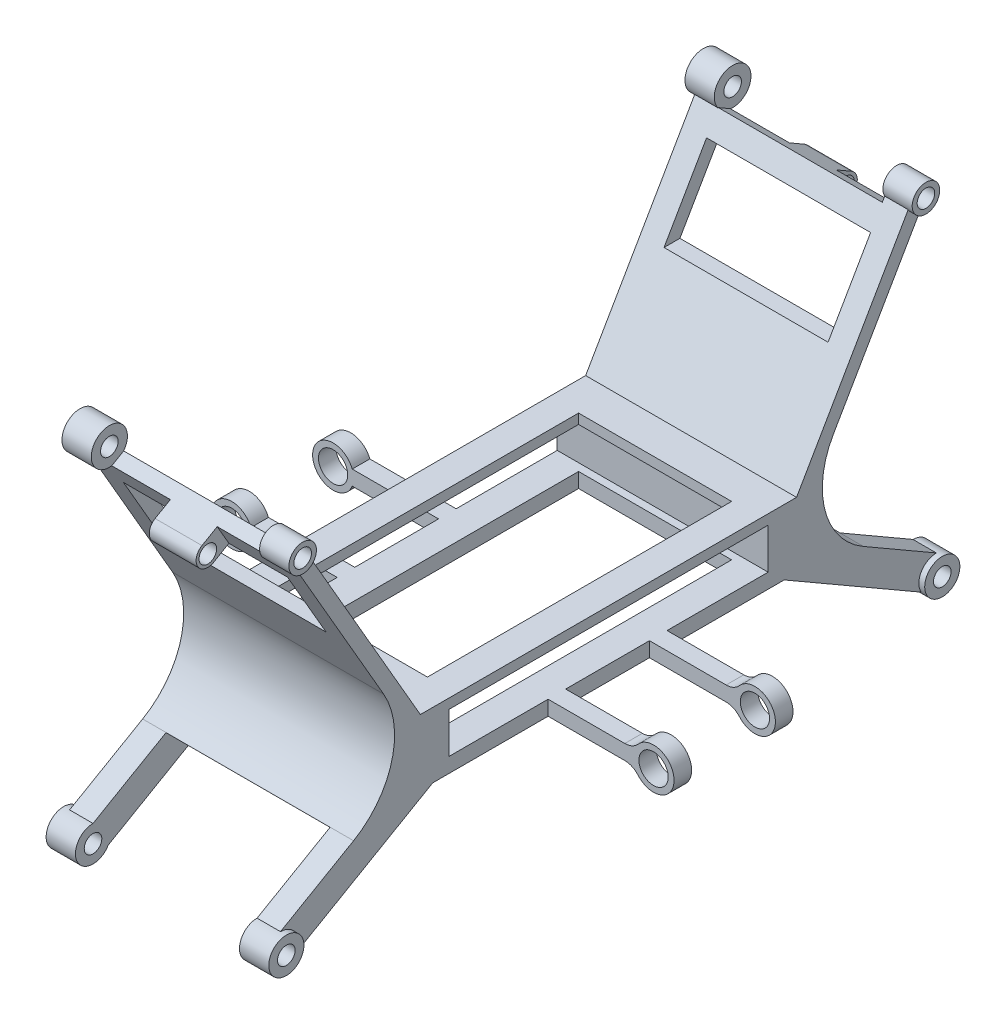
from build123d import *
from build123d.topology import SkipClean

# Parameters (mm, degrees)
BOSS_EXTRUDE2_DEPTH     = 360
SKETCH3_W               = 545.106506056
SKETCH3_H               = 69.533125986
CUT_EXTRUDE1_DEPTH      = 360
SKETCH4_W               = 261.239789208
SKETCH4_H               = 519.237085056
CUT_EXTRUDE2_DEPTH      = 760.209392128
CUT_EXTRUDE4_DEPTH      = 1270.062663896
CUT_EXTRUDE4_DEPTH_BACK = 1270.062663896
SKETCH5_W               = 280
SKETCH5_H               = 202.839703821
SKETCH6_W               = 280
SKETCH6_H               = 40
BOSS_EXTRUDE3_DEPTH     = 23.50994
SKETCH8_W               = 280
SKETCH8_H               = 40
BOSS_EXTRUDE4_DEPTH     = 23.509942
SKETCH9_W               = 80
SKETCH9_H               = 40
BOSS_EXTRUDE5_DEPTH     = 30
SKETCH10_W              = 80
SKETCH10_H              = 40
BOSS_EXTRUDE6_DEPTH     = 30
BOSS_EXTRUDE8_START     = -80
SKETCH13_R              = 20
BOSS_EXTRUDE8_DEPTH     = 80
CUT_EXTRUDE5_DEPTH      = 771.769639674
CUT_EXTRUDE5_DEPTH_BACK = 771.769639674
SKETCH14_R              = 15
BOSS_EXTRUDE9_START     = -80
SKETCH15_R              = 20
BOSS_EXTRUDE9_DEPTH     = 80
SKETCH16_R              = 15
CUT_EXTRUDE6_DEPTH      = 771.501076275
BOSS_EXTRUDE10_START    = -40
SKETCH17_R              = 30
BOSS_EXTRUDE10_DEPTH    = 50
BOSS_EXTRUDE11_START    = -40
SKETCH18_R              = 30
BOSS_EXTRUDE11_DEPTH    = 50
BOSS_EXTRUDE12_START    = -40
SKETCH19_R              = 30
BOSS_EXTRUDE12_DEPTH    = 50
BOSS_EXTRUDE13_START    = -40
SKETCH20_R              = 30
BOSS_EXTRUDE13_DEPTH    = 50
SKETCH21_R              = 15
CUT_EXTRUDE7_DEPTH      = 849.324692626
SKETCH22_R              = 15
CUT_EXTRUDE8_DEPTH      = 849.324692626
BOSS_EXTRUDE14_START    = -40
SKETCH23_R              = 23.509939841
BOSS_EXTRUDE14_DEPTH    = 50
BOSS_EXTRUDE15_START    = -40
SKETCH24_R              = 30.874513824
BOSS_EXTRUDE15_DEPTH    = 50
BOSS_EXTRUDE16_START    = -40
SKETCH25_R              = 23.509941867
BOSS_EXTRUDE16_DEPTH    = 50
BOSS_EXTRUDE17_START    = -40
SKETCH26_R              = 31.331553509
BOSS_EXTRUDE17_DEPTH    = 50
SKETCH27_R              = 15
CUT_EXTRUDE9_DEPTH      = 853.745779455
SKETCH28_R              = 15
CUT_EXTRUDE10_DEPTH     = 853.745779455
SKETCH30_W              = 30
SKETCH30_H              = 25.233437007
BOSS_EXTRUDE18_DEPTH    = 180
BOSS_EXTRUDE19_START    = -30
SKETCH31_R              = 35
BOSS_EXTRUDE19_DEPTH    = 30
BOSS_EXTRUDE20_START    = -30
SKETCH32_R              = 35
BOSS_EXTRUDE20_DEPTH    = 30
SKETCH33_R              = 25
CUT_EXTRUDE11_DEPTH     = 1023.514742227
FILLET1_R               = 30
SKETCH34_W              = 30
SKETCH34_H              = 25.233437007
BOSS_EXTRUDE21_DEPTH    = 180
BOSS_EXTRUDE22_START    = -30
SKETCH35_R              = 35
BOSS_EXTRUDE22_DEPTH    = 30
BOSS_EXTRUDE23_START    = -30
SKETCH36_R              = 35
BOSS_EXTRUDE23_DEPTH    = 30
SKETCH37_R              = 25
CUT_EXTRUDE12_DEPTH     = 1021.47140509


with BuildPart() as part:
    # Sketch1 → Boss-Extrude2 (new body)
    with BuildSketch(Plane(origin=(0, 0, 0), x_dir=(0, 0, -1), z_dir=(1, 0, 0))):
        with BuildLine():
            Line((0, 0), (-300, 0))
            Line((-300, 0), (-559.807621135, -150))
            Line((-559.807621135, -150), (-559.807621135, -90))
            Line((-559.807621135, -90), (-435.056850285, -17.975108868))
            ThreePointArc((-435.056850285, -17.975108868), (-369.827234604, 67.033781348), (-383.813293755, 173.268447662))
            Line((-383.813293755, 173.268447662), (-531.936721095, 429.825749606))
            Line((-531.936721095, 429.825749606), (-531.936721095, 476.845629287))
            Line((-531.936721095, 476.845629287), (-321.054187904, 111.586367372))
            Line((-321.054187904, 111.586367372), (321.054185564, 111.586367372))
            Line((321.054185564, 111.586367372), (531.936718755, 476.845629287))
            Line((531.936718755, 476.845629287), (531.936718755, 429.825745553))
            Line((531.936718755, 429.825745553), (383.813293755, 173.268447662))
            ThreePointArc((383.813293755, 173.268447662), (369.827234604, 67.033781348), (435.056850285, -17.975108868))
            Line((435.056850285, -17.975108868), (559.807621135, -90))
            Line((559.807621135, -90), (559.807621135, -150))
            Line((559.807621135, -150), (300, 0))
            Line((300, 0), (0, 0))
        make_face()
    extrude(amount=BOSS_EXTRUDE2_DEPTH)

    # Sketch3 → Cut-Extrude1 (cut)
    with BuildSketch(Plane(origin=(360, 0, 0), x_dir=(0, 0, -1), z_dir=(1, 0, 0))):
        with Locations((0, 60)):
            Rectangle(SKETCH3_W, SKETCH3_H)
    extrude(amount=-CUT_EXTRUDE1_DEPTH, mode=Mode.SUBTRACT)

    # Sketch4 → Cut-Extrude2 (cut, through all)
    with BuildSketch(Plane(origin=(0, 111.586367372, 0), x_dir=(1, 0, 0), z_dir=(0, 1, 0))):
        with Locations((180, 0)):
            Rectangle(SKETCH4_W, SKETCH4_H)
    extrude(amount=-CUT_EXTRUDE2_DEPTH, mode=Mode.SUBTRACT)

    # Sketch5 → Cut-Extrude4 (cut, two sides: drawn at the far end of the back side and taken through both)
    with BuildSketch(Plane(origin=(0, 0, -559.807621135), x_dir=(-1, 0, 0), z_dir=(0, 0, -1)).offset(-CUT_EXTRUDE4_DEPTH_BACK)):
        Polygon((-320, -90), (-320, -18.068354254), (-40, -18.068354254), (-40, -90), (-40, -150), (-320, -150), align=None)
        with Locations((-180, 375.425777377)):
            Rectangle(SKETCH5_W, SKETCH5_H)
    extrude(amount=CUT_EXTRUDE4_DEPTH + CUT_EXTRUDE4_DEPTH_BACK, mode=Mode.SUBTRACT)

    # Sketch6 → Boss-Extrude3 (add)
    with SkipClean():  # the faces are left unmerged after this step: merging them gives an invalid solid
        with BuildSketch(Plane(origin=(0, -122.878919435, 212.832531641), x_dir=(1, 0, 0), z_dir=(0, -0.5000000000000043, 0.8660254037844363))):
            with Locations((180, 610.008378907)):
                Rectangle(SKETCH6_W, SKETCH6_H)
        extrude(amount=-BOSS_EXTRUDE3_DEPTH)

    # Sketch8 → Boss-Extrude4 (add)
    with SkipClean():  # the faces are left unmerged after this step: merging them gives an invalid solid
        with BuildSketch(Plane(origin=(0, -122.878919435, -212.832531641), x_dir=(-1, 0, 0), z_dir=(0, -0.500000000000012, -0.8660254037844318))):
            with Locations((-180, 610.008374227)):
                Rectangle(SKETCH8_W, SKETCH8_H)
        extrude(amount=-BOSS_EXTRUDE4_DEPTH)

    # Sketch9 → Boss-Extrude5 (add)
    with SkipClean():  # the faces are left unmerged after this step: merging them gives an invalid solid
        with BuildSketch(Plane(origin=(0, -122.878919435, -212.832531641), x_dir=(-1, 0, 0), z_dir=(0, -0.500000000000012, -0.8660254037844318))):
            with Locations((-180.938750654, 610.008374227)):
                Rectangle(SKETCH9_W, SKETCH9_H)
        extrude(amount=BOSS_EXTRUDE5_DEPTH)

    # Sketch10 → Boss-Extrude6 (add)
    with SkipClean():  # the faces are left unmerged after this step: merging them gives an invalid solid
        with BuildSketch(Plane(origin=(0, -122.878919435, 212.832531641), x_dir=(1, 0, 0), z_dir=(0, -0.5000000000000043, 0.8660254037844363))):
            with Locations((180, 610.008378907)):
                Rectangle(SKETCH10_W, SKETCH10_H)
        extrude(amount=BOSS_EXTRUDE6_DEPTH)

    # Sketch13 → Boss-Extrude8 (add)
    with SkipClean():  # the faces are left unmerged after this step: merging them gives an invalid solid
        with BuildSketch(Plane(origin=(220.938750654, 0, 0), x_dir=(0, 0, -1), z_dir=(1, 0, 0)).offset(BOSS_EXTRUDE8_START)):
            with Locations((543.817480868, 390.403829166)):
                Circle(SKETCH13_R)
        extrude(amount=BOSS_EXTRUDE8_DEPTH)

    # Sketch14 → Cut-Extrude5 (cut, two sides: drawn at the far end of the back side and taken through both)
    with SkipClean():  # the faces are left unmerged after this step: merging them gives an invalid solid
        with BuildSketch(Plane(origin=(220.938750654, 0, 0), x_dir=(0, 0, -1), z_dir=(1, 0, 0)).offset(-CUT_EXTRUDE5_DEPTH_BACK)):
            with Locations((543.817480868, 390.403829166)):
                Circle(SKETCH14_R)
        extrude(amount=CUT_EXTRUDE5_DEPTH + CUT_EXTRUDE5_DEPTH_BACK, mode=Mode.SUBTRACT)

    # Sketch15 → Boss-Extrude9 (add)
    with SkipClean():  # the faces are left unmerged after this step: merging them gives an invalid solid
        with BuildSketch(Plane(origin=(220, 0, 0), x_dir=(0, 0, -1), z_dir=(1, 0, 0)).offset(BOSS_EXTRUDE9_START)):
            with Locations((-543.817483208, 390.403833219)):
                Circle(SKETCH15_R)
        extrude(amount=BOSS_EXTRUDE9_DEPTH)

    # Sketch16 → Cut-Extrude6 (cut, through all)
    with SkipClean():  # the faces are left unmerged after this step: merging them gives an invalid solid
        with BuildSketch(Plane(origin=(220, 0, 0), x_dir=(0, 0, -1), z_dir=(1, 0, 0))):
            with Locations((-543.817483208, 390.403833219)):
                Circle(SKETCH16_R)
        extrude(amount=-CUT_EXTRUDE6_DEPTH, mode=Mode.SUBTRACT)

    # Sketch17 → Boss-Extrude10 (add)
    with SkipClean():  # the faces are left unmerged after this step: merging them gives an invalid solid
        with BuildSketch(Plane(origin=(360, 0, 0), x_dir=(0, 0, -1), z_dir=(1, 0, 0)).offset(BOSS_EXTRUDE10_START)):
            with Locations(Location((-559.807621135, -120, 0), (0, 0, 90))):
                Circle(SKETCH17_R)
        extrude(amount=BOSS_EXTRUDE10_DEPTH)

    # Sketch18 → Boss-Extrude11 (add)
    with SkipClean():  # the faces are left unmerged after this step: merging them gives an invalid solid
        with BuildSketch(Plane.ZY.offset(BOSS_EXTRUDE11_START)):
            with Locations(Location((559.807621135, -120, 0), (0, 0, 90))):
                Circle(SKETCH18_R)
        extrude(amount=BOSS_EXTRUDE11_DEPTH)

    # Sketch19 → Boss-Extrude12 (add)
    with SkipClean():  # the faces are left unmerged after this step: merging them gives an invalid solid
        with BuildSketch(Plane(origin=(360, 0, 0), x_dir=(0, 0, -1), z_dir=(1, 0, 0)).offset(BOSS_EXTRUDE12_START)):
            with Locations(Location((559.807621135, -120, 0), (0, 0, 210))):
                Circle(SKETCH19_R)
        extrude(amount=BOSS_EXTRUDE12_DEPTH)

    # Sketch20 → Boss-Extrude13 (add)
    with SkipClean():  # the faces are left unmerged after this step: merging them gives an invalid solid
        with BuildSketch(Plane.ZY.offset(BOSS_EXTRUDE13_START)):
            with Locations(Location((-559.807621135, -120, 0), (0, 0, 330))):
                Circle(SKETCH20_R)
        extrude(amount=BOSS_EXTRUDE13_DEPTH)

    # Sketch21 → Cut-Extrude7 (cut, through all)
    with SkipClean():  # the faces are left unmerged after this step: merging them gives an invalid solid
        with BuildSketch(Plane(origin=(370, 0, 0), x_dir=(0, 0, -1), z_dir=(1, 0, 0))):
            with Locations((559.807621135, -120)):
                Circle(SKETCH21_R)
        extrude(amount=-CUT_EXTRUDE7_DEPTH, mode=Mode.SUBTRACT)

    # Sketch22 → Cut-Extrude8 (cut, through all)
    with SkipClean():  # the faces are left unmerged after this step: merging them gives an invalid solid
        with BuildSketch(Plane(origin=(370, 0, 0), x_dir=(0, 0, -1), z_dir=(1, 0, 0))):
            with Locations((-559.807621135, -120)):
                Circle(SKETCH22_R)
        extrude(amount=-CUT_EXTRUDE8_DEPTH, mode=Mode.SUBTRACT)

    # Sketch23 → Boss-Extrude14 (add)
    with SkipClean():  # the faces are left unmerged after this step: merging them gives an invalid solid
        with BuildSketch(Plane(origin=(360, 0, 0), x_dir=(0, 0, -1), z_dir=(1, 0, 0)).offset(BOSS_EXTRUDE14_START)):
            with Locations(Location((-531.936721095, 453.335689447, 0), (0, 0, 270))):
                Circle(SKETCH23_R)
        extrude(amount=BOSS_EXTRUDE14_DEPTH)

    # Sketch24 → Boss-Extrude15 (add)
    with SkipClean():  # the faces are left unmerged after this step: merging them gives an invalid solid
        with BuildSketch(Plane.ZY.offset(BOSS_EXTRUDE15_START)):
            with Locations(Location((531.936721095, 453.335689447, 0), (0, 0, 217.620858787))):
                Circle(SKETCH24_R)
        extrude(amount=BOSS_EXTRUDE15_DEPTH)

    # Sketch25 → Boss-Extrude16 (add)
    with SkipClean():  # the faces are left unmerged after this step: merging them gives an invalid solid
        with BuildSketch(Plane(origin=(360, 0, 0), x_dir=(0, 0, -1), z_dir=(1, 0, 0)).offset(BOSS_EXTRUDE16_START)):
            with Locations(Location((531.936718755, 453.33568742, 0), (0, 0, 210))):
                Circle(SKETCH25_R)
        extrude(amount=BOSS_EXTRUDE16_DEPTH)

    # Sketch26 → Boss-Extrude17 (add)
    with SkipClean():  # the faces are left unmerged after this step: merging them gives an invalid solid
        with BuildSketch(Plane.ZY.offset(BOSS_EXTRUDE17_START)):
            with Locations(Location((-531.936718755, 453.33568742, 0), (0, 0, 277.964564218))):
                Circle(SKETCH26_R)
        extrude(amount=BOSS_EXTRUDE17_DEPTH)

    # Sketch27 → Cut-Extrude9 (cut, through all)
    with SkipClean():  # the faces are left unmerged after this step: merging them gives an invalid solid
        with BuildSketch(Plane.ZY.offset(10)):
            with Locations((-531.936718755, 453.33568742)):
                Circle(SKETCH27_R)
        extrude(amount=-CUT_EXTRUDE9_DEPTH, mode=Mode.SUBTRACT)

    # Sketch28 → Cut-Extrude10 (cut, through all)
    with SkipClean():  # the faces are left unmerged after this step: merging them gives an invalid solid
        with BuildSketch(Plane.ZY.offset(10)):
            with Locations((531.936721095, 453.335689447)):
                Circle(SKETCH28_R)
        extrude(amount=-CUT_EXTRUDE10_DEPTH, mode=Mode.SUBTRACT)

    # Sketch30 → Boss-Extrude18 (add)
    with SkipClean():  # the faces are left unmerged after this step: merging them gives an invalid solid
        with BuildSketch(Plane(origin=(360, 0, 0), x_dir=(0, 0, -1), z_dir=(1, 0, 0))):
            with Locations((-88.019242982, 12.616718504)):
                Rectangle(SKETCH30_W, SKETCH30_H)
            with Locations((85, 12.616718504)):
                Rectangle(SKETCH30_W, SKETCH30_H)
        extrude(amount=BOSS_EXTRUDE18_DEPTH)

    # Sketch31 → Boss-Extrude19 (add)
    with SkipClean():  # the faces are left unmerged after this step: merging them gives an invalid solid
        with BuildSketch(Plane.XY.offset(103.019242982).offset(BOSS_EXTRUDE19_START)):
            with Locations((540, 12.616718504)):
                Circle(SKETCH31_R)
        extrude(amount=BOSS_EXTRUDE19_DEPTH)

    # Sketch32 → Boss-Extrude20 (add)
    with SkipClean():  # the faces are left unmerged after this step: merging them gives an invalid solid
        with BuildSketch(Plane(origin=(0, 0, -100), x_dir=(-1, 0, 0), z_dir=(0, 0, -1)).offset(BOSS_EXTRUDE20_START)):
            with Locations((-540, 12.616718504)):
                Circle(SKETCH32_R)
        extrude(amount=BOSS_EXTRUDE20_DEPTH)

    # Sketch33 → Cut-Extrude11 (cut, through all)
    with SkipClean():  # the faces are left unmerged after this step: merging them gives an invalid solid
        with BuildSketch(Plane.XY.offset(103.019242982)):
            with Locations((540, 12.616718504)):
                Circle(SKETCH33_R)
        extrude(amount=-CUT_EXTRUDE11_DEPTH, mode=Mode.SUBTRACT)

    # Fillet1
    fillet1_edges = [part.edges().sort_by_distance(p)[0] for p in [
        (507.353125506, 0, 88.019242982),
        (507.353125506, 25.233437007, 88.019242982),
        (507.353125506, 0, -85),
        (507.353125506, 25.233437007, -85),
    ]]
    fillet(fillet1_edges, radius=FILLET1_R)

    # Sketch34 → Boss-Extrude21 (add)
    with SkipClean():  # the faces are left unmerged after this step: merging them gives an invalid solid
        with BuildSketch(Plane.ZY):
            with Locations((-85, 12.616718504)):
                Rectangle(SKETCH34_W, SKETCH34_H)
            with Locations((88.019242982, 12.616718504)):
                Rectangle(SKETCH34_W, SKETCH34_H)
        extrude(amount=BOSS_EXTRUDE21_DEPTH)

    # Sketch35 → Boss-Extrude22 (add)
    with SkipClean():  # the faces are left unmerged after this step: merging them gives an invalid solid
        with BuildSketch(Plane.XY.offset(103.019242982).offset(BOSS_EXTRUDE22_START)):
            with Locations((-180, 12.616718504)):
                Circle(SKETCH35_R)
        extrude(amount=BOSS_EXTRUDE22_DEPTH)

    # Sketch36 → Boss-Extrude23 (add)
    with SkipClean():  # the faces are left unmerged after this step: merging them gives an invalid solid
        with BuildSketch(Plane(origin=(0, 0, -100), x_dir=(-1, 0, 0), z_dir=(0, 0, -1)).offset(BOSS_EXTRUDE23_START)):
            with Locations((180, 12.616718504)):
                Circle(SKETCH36_R)
        extrude(amount=BOSS_EXTRUDE23_DEPTH)

    # Sketch37 → Cut-Extrude12 (cut, through all)
    with SkipClean():  # the faces are left unmerged after this step: merging them gives an invalid solid
        with BuildSketch(Plane(origin=(0, 0, -100), x_dir=(-1, 0, 0), z_dir=(0, 0, -1))):
            with Locations((180, 12.616718504)):
                Circle(SKETCH37_R)
        extrude(amount=-CUT_EXTRUDE12_DEPTH, mode=Mode.SUBTRACT)


solid = part.part
